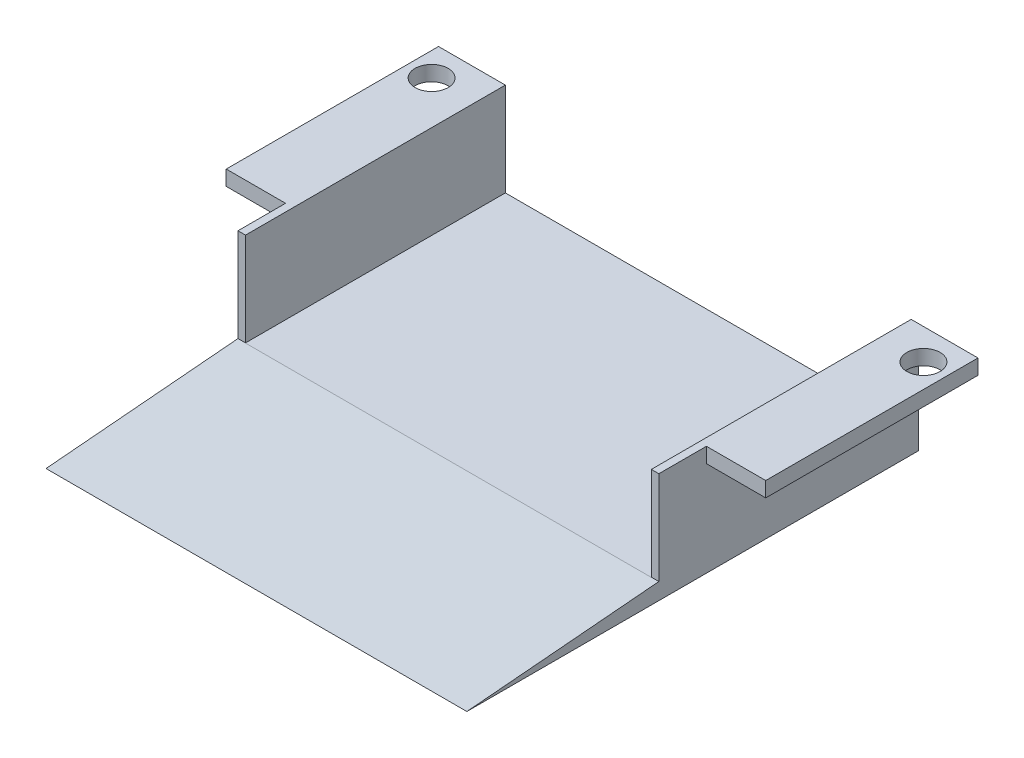
from build123d import *

# Parameters (mm, degrees)
SKETCH1_W           = 454.914
SKETCH1_H           = 381
BOSS_EXTRUDE1_DEPTH = 92.6973
SKETCH3_W           = 50.0126
SKETCH3_H           = 202.0062
CUT_EXTRUDE1_DEPTH  = 601.583496962
SKETCH4_R           = 14
CUT_EXTRUDE2_DEPTH  = 601.583496962
SKETCH5_W           = 342.1888
SKETCH5_H           = 381
CUT_EXTRUDE3_DEPTH  = 78.74
SKETCH6_W           = 178.9938
SKETCH6_H           = 79.9974
CUT_EXTRUDE4_DEPTH  = 50.0126
SKETCH7_W           = 178.9938
SKETCH7_H           = 79.9974
CUT_EXTRUDE5_DEPTH  = 50.0126
CUT_EXTRUDE6_DEPTH  = 564.647880462


with BuildPart() as part:
    # Sketch1 → Boss-Extrude1 (new body)
    with BuildSketch(Plane(origin=(0, 0, 0), x_dir=(1, 0, 0), z_dir=(0, 1, 0))):
        with Locations((227.457, 190.5)):
            Rectangle(SKETCH1_W, SKETCH1_H)
    extrude(amount=BOSS_EXTRUDE1_DEPTH)

    # Sketch3 → Cut-Extrude1 (cut, through all)
    with BuildSketch(Plane(origin=(0, 92.6973, 0), x_dir=(1, 0, 0), z_dir=(0, 1, 0))):
        with Locations((429.9077, 101.0031)):
            Rectangle(SKETCH3_W, SKETCH3_H)
        with Locations((25.0063, 101.0031)):
            Rectangle(SKETCH3_W, SKETCH3_H)
    extrude(amount=-CUT_EXTRUDE1_DEPTH, mode=Mode.SUBTRACT)

    # Sketch4 → Cut-Extrude2 (cut, through all)
    with BuildSketch(Plane(origin=(0, 92.6973, 0), x_dir=(1, 0, 0), z_dir=(0, 1, 0))):
        with Locations((20.066, 355.092)):
            Circle(SKETCH4_R)
        with Locations((434.848, 355.092)):
            Circle(SKETCH4_R)
    extrude(amount=-CUT_EXTRUDE2_DEPTH, mode=Mode.SUBTRACT)

    # Sketch5 → Cut-Extrude3 (cut)
    with BuildSketch(Plane(origin=(0, 92.6973, 0), x_dir=(1, 0, 0), z_dir=(0, 1, 0))):
        with Locations((227.457, 190.5)):
            Rectangle(SKETCH5_W, SKETCH5_H)
    extrude(amount=-CUT_EXTRUDE3_DEPTH, mode=Mode.SUBTRACT)

    # Sketch6 → Cut-Extrude4 (cut)
    with BuildSketch(Plane(origin=(454.914, 0, 0), x_dir=(0, 0, -1), z_dir=(1, 0, 0))):
        with Locations((291.5031, 39.9987)):
            Rectangle(SKETCH6_W, SKETCH6_H)
    extrude(amount=-CUT_EXTRUDE4_DEPTH, mode=Mode.SUBTRACT)

    # Sketch7 → Cut-Extrude5 (cut)
    with BuildSketch(Plane.ZY):
        with Locations((-291.5031, 39.9987)):
            Rectangle(SKETCH7_W, SKETCH7_H)
    extrude(amount=-CUT_EXTRUDE5_DEPTH, mode=Mode.SUBTRACT)

    # Sketch10 → Cut-Extrude6 (cut, through all)
    with BuildSketch(Plane(origin=(404.9014, 0, 0), x_dir=(0, 0, -1), z_dir=(1, 0, 0))):
        Polygon((0, 0), (161.899498709, 13.97), (161.899498709, 92.6973), (0, 92.6973), align=None)
    extrude(amount=-CUT_EXTRUDE6_DEPTH, mode=Mode.SUBTRACT)


solid = part.part
